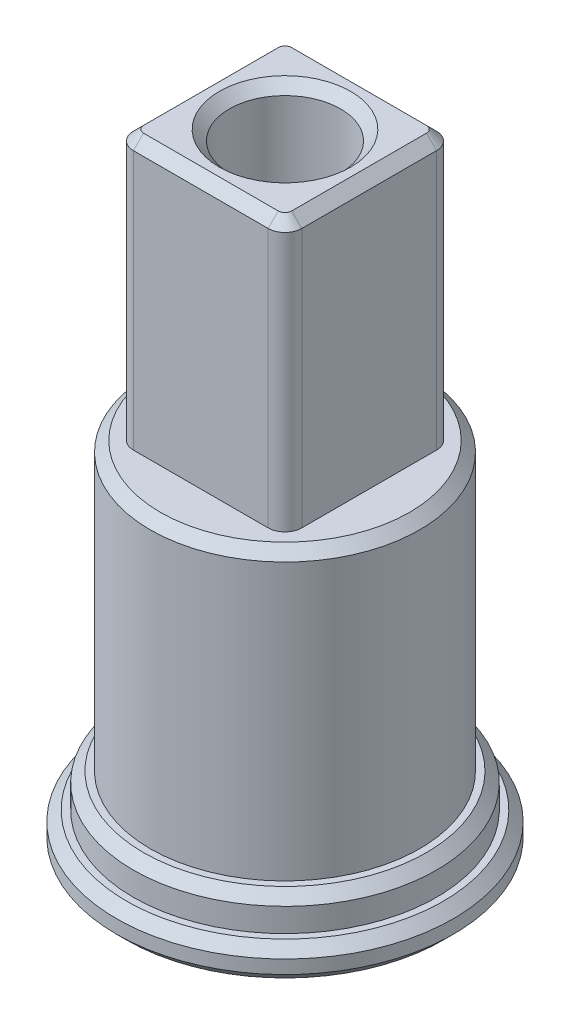
from build123d import *

# Parameters (mm, degrees)
SKETCH_1_R          = 5
SKETCH_1_R_2        = 4.5
EXTRUDE_1_DEPTH     = 1
SKETCH_1_5_R        = 4.5
SKETCH_1_5_R_2      = 4
EXTRUDE_2_DEPTH     = 2
SKETCH_1_6_R        = 4
EXTRUDE_3_DEPTH     = 10.5
SKETCH_1_7_W        = 5
SKETCH_1_7_H        = 5
EXTRUDE_4_DEPTH     = 18.5
CUT_EXTRUDE_1_DEPTH = 1
SKETCH_5_R          = 1.65
CUT_EXTRUDE_2_DEPTH = 10
FILLET_1_R          = 0.5
CHAMFER_1_SIZE      = 0.3


with BuildPart() as part:
    # 스케치1 → 보스-돌출1 (new body)
    with BuildSketch(Plane(origin=(0, 0, 0), x_dir=(1, 0, 0), z_dir=(0, 1, 0))):
        Circle(SKETCH_1_R)
        Circle(SKETCH_1_R_2, mode=Mode.SUBTRACT)
    extrude(amount=EXTRUDE_1_DEPTH)

    # 스케치1<5> → 보스-돌출2 (add)
    with BuildSketch(Plane(origin=(0, 0, 0), x_dir=(1, 0, 0), z_dir=(0, 1, 0))):
        Circle(SKETCH_1_5_R)
        Circle(SKETCH_1_5_R_2, mode=Mode.SUBTRACT)
    extrude(amount=EXTRUDE_2_DEPTH)

    # 스케치1<6> → 보스-돌출3 (add)
    with BuildSketch(Plane(origin=(0, 0, 0), x_dir=(1, 0, 0), z_dir=(0, 1, 0))):
        Circle(SKETCH_1_6_R)
    extrude(amount=EXTRUDE_3_DEPTH)

    # 스케치1<7> → 보스-돌출4 (add)
    with BuildSketch(Plane(origin=(0, 0, 0), x_dir=(1, 0, 0), z_dir=(0, 1, 0))):
        Rectangle(SKETCH_1_7_W, SKETCH_1_7_H)
    extrude(amount=EXTRUDE_4_DEPTH)

    # 스케치3 → 컷-돌출1 (cut)
    with BuildSketch(Plane.XZ):
        with BuildLine():
            Line((1, 1), (1, -1))
            ThreePointArc((1, -1), (0, -2), (-1, -1))
            Line((-1, -1), (-1, 1))
            ThreePointArc((-1, 1), (0, 2), (1, 1))
        make_face()
    extrude(amount=-CUT_EXTRUDE_1_DEPTH, mode=Mode.SUBTRACT)

    # 스케치4 → 컷-회전1 (revolve, cut)
    with BuildSketch(Plane.XY):
        Polygon((0, 8.5), (-1.65, 8.5), (0, 7.816547622), align=None)
    revolve(axis=Axis((0, -0.586194708, 0), (0, 1, 0)), mode=Mode.SUBTRACT)

    # 스케치5 → 컷-돌출2 (cut)
    with BuildSketch(Plane(origin=(0, 18.5, 0), x_dir=(1, 0, 0), z_dir=(0, 1, 0))):
        Circle(SKETCH_5_R)
    extrude(amount=-CUT_EXTRUDE_2_DEPTH, mode=Mode.SUBTRACT)

    # 필렛1
    fillet_1_edges = [part.edges().sort_by_distance(p)[0] for p in [
        (2.5, 14.5, 2.5),
        (2.5, 14.5, -2.5),
        (-2.5, 14.5, 2.5),
        (-2.5, 14.5, -2.5),
    ]]
    fillet(fillet_1_edges, radius=FILLET_1_R)

    # 모따기1
    chamfer_1_edges = [part.edges().sort_by_distance(p)[0] for p in [
        (-1.65, 18.5, 0),
        (-5, 0, 0),
        (-5, 1, 0),
        (-4.5, 2, 0),
        (-4, 10.5, 0),
        (2.5, 18.5, 0),
        (0, 18.5, -2.5),
        (-2.5, 18.5, 0),
        (0, 18.5, 2.5),
        (2.353553391, 18.5, 2.353553391),
        (-2.353553391, 18.5, 2.353553391),
        (2.353553391, 18.5, -2.353553391),
        (-2.353553391, 18.5, -2.353553391),
    ]]
    chamfer(chamfer_1_edges, length=CHAMFER_1_SIZE)


solid = part.part
